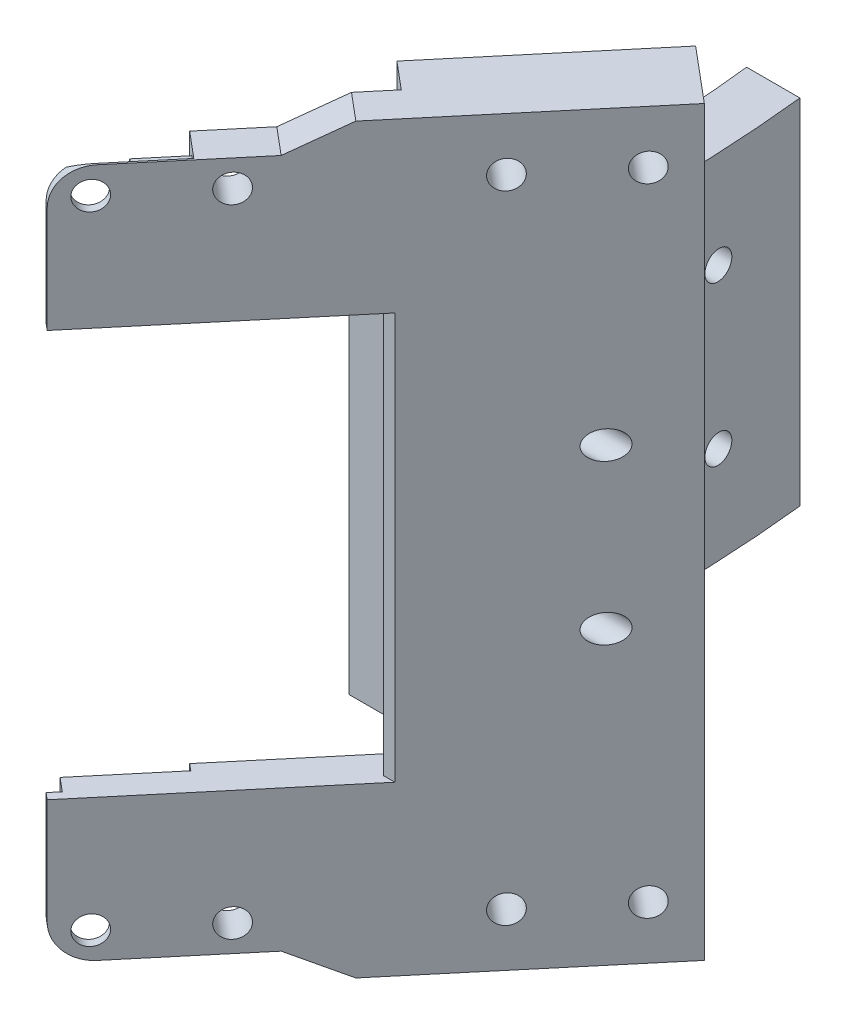
from build123d import *

# Parameters (mm, degrees)
EXTRUDE_1_DEPTH     = 1
SKETCH_2_W          = 24
SKETCH_2_H          = 84
EXTRUDE_2_DEPTH     = 8
CUT_EXTRUDE_1_DEPTH = 30
SKETCH_4_R          = 1.6
CUT_EXTRUDE_2_DEPTH = 12
SKETCH_5_W          = 60
SKETCH_5_H          = 46
CUT_EXTRUDE_3_DEPTH = 50
EXTRUDE_3_DEPTH     = 40
SKETCH_9_R          = 1.6
CUT_EXTRUDE_4_DEPTH = 70
EXTRUDE_8_DEPTH     = 6
EXTRUDE_9_DEPTH     = 6
SKETCH_18_W         = 10.5
SKETCH_18_H         = 9
EXTRUDE_11_DEPTH    = 3
SKETCH_21_W         = 5
SKETCH_21_H         = 6
EXTRUDE_13_DEPTH    = 2
EXTRUDE_14_DEPTH    = 4
SKETCH_24_R         = 1.6
CUT_EXTRUDE_7_DEPTH = 12


with BuildPart() as part:
    # 草图1 → 凸台-拉伸1 (new body)
    with BuildSketch(Plane(origin=(159.175409567, 0, 133.564027461), x_dir=(0.6427876096867067, 0, -0.7660444431188377), z_dir=(0.7660444431188378, 0, 0.6427876096867067))):
        with BuildLine():
            Line((166.587338197, -42), (166.587338197, 42))
            Line((166.587338197, 42), (138.587338197, 42))
            Line((138.587338197, 42), (132.587338197, 39))
            Line((132.587338197, 39), (117.787338197, 39))
            ThreePointArc((117.787338197, 39), (114.958911072, 37.828427125), (113.787338197, 35))
            Line((113.787338197, 35), (113.787338197, -35))
            ThreePointArc((113.787338197, -35), (114.958911072, -37.828427125), (117.787338197, -39))
            Line((117.787338197, -39), (132.587338197, -39))
            Line((132.587338197, -39), (138.587338197, -42))
            Line((138.587338197, -42), (166.587338197, -42))
        make_face()
    extrude(amount=-EXTRUDE_1_DEPTH)

    # 草图2 → 凸台-拉伸2 (add)
    with BuildSketch(Plane(origin=(159.175409567, 0, 133.564027461), x_dir=(0.6427876096867067, 0, -0.7660444431188377), z_dir=(0.7660444431188378, 0, 0.6427876096867067))):
        with Locations((154.587338197, 0)):
            Rectangle(SKETCH_2_W, SKETCH_2_H)
    extrude(amount=-EXTRUDE_2_DEPTH)

    # 草图3 → 切除-拉伸1 (cut)
    with BuildSketch(Plane(origin=(85.225498194, 0, -101.567793654), x_dir=(0.7660444431188381, 0, 0.6427876096867062), z_dir=(-0.6427876096867063, 0, 0.7660444431188381))):
        Polygon((206.788739932, -38.2), (207.588739932, -39), (207.588739932, -50), (197.788739932, -50), (197.788739932, -38.2), align=None)
        Polygon((206.788739932, 38.2), (207.588739932, 39), (207.588739932, 50), (197.788739932, 50), (197.788739932, 38.2), align=None)
    extrude(amount=CUT_EXTRUDE_1_DEPTH, mode=Mode.SUBTRACT)

    # 草图4 → 切除-拉伸2 (cut)
    with BuildSketch(Plane(origin=(159.175409567, 0, 133.564027461), x_dir=(0.6427876096867067, 0, -0.7660444431188377), z_dir=(0.7660444431188378, 0, 0.6427876096867067))):
        with Locations((117.287338197, -36)):
            Circle(SKETCH_4_R)
        with Locations((117.287338197, 36)):
            Circle(SKETCH_4_R)
        with Locations((150.687338197, 36)):
            Circle(SKETCH_4_R)
        with Locations((128.687338197, 36)):
            Circle(SKETCH_4_R)
        with Locations((128.687338197, -36)):
            Circle(SKETCH_4_R)
        with Locations((162.087338197, 36)):
            Circle(SKETCH_4_R)
        with Locations((162.087338197, -36)):
            Circle(SKETCH_4_R)
        with Locations((150.687338197, -36)):
            Circle(SKETCH_4_R)
    extrude(amount=-CUT_EXTRUDE_2_DEPTH, mode=Mode.SUBTRACT)

    # 草图5 → 切除-拉伸3 (cut)
    with BuildSketch(Plane.XY.offset(25)):
        with Locations((250, 0)):
            Rectangle(SKETCH_5_W, SKETCH_5_H)
    extrude(amount=CUT_EXTRUDE_3_DEPTH, mode=Mode.SUBTRACT)

    # 草图6 → 凸台-拉伸3 (add)
    with BuildSketch(Plane(origin=(0, 20, 0), x_dir=(-1, 0, 0), z_dir=(0, -1, 0))):
        with BuildLine():
            Line((-249.1237949, 22), (-243.086632908, 22))
            add(Edge.make_bspline(
                [(-243.086632908, 22), (-243.481254737, 18.531426174), (-243.784948463, 14.933770973), (-243.993041019, 11.223078881), (-244.1, 7.416444076), (-244.1, 3.53121788)],
                knots=[0.778865295, 0.778865295, 0.778865295, 0.778865295, 0.778865295, 0.778865295, 1, 1, 1, 1, 1, 1], degree=5))
            add(Edge.make_bspline(
                [(-244.1, 3.53121788), (-244.1, -1.069863619), (-243.955995612, -5.56513348), (-243.676385618, -9.929661799), (-243.268946043, -14.139045721), (-242.741071446, -18.169549128), (-242.097814731, -22)],
                knots=[0, 0, 0, 0, 0, 0, 0, 0.314254692, 0.314254692, 0.314254692, 0.314254692, 0.314254692, 0.314254692, 0.314254692], degree=6))
            Line((-242.097814731, -22), (-248.177885229, -22))
            add(Edge.make_bspline(
                [(-248.177885229, -22), (-248.800145217, -18.111595668), (-249.307087627, -14.054845034), (-249.696626763, -9.84368942), (-249.96306742, -5.496084567), (-250.1, -1.031127344), (-250.1, 3.53121788)],
                knots=[0.698640687, 0.698640687, 0.698640687, 0.698640687, 0.698640687, 0.698640687, 0.698640687, 1, 1, 1, 1, 1, 1, 1], degree=6))
            add(Edge.make_bspline(
                [(-250.1, 3.53121788), (-250.1, 7.398092065), (-249.997534101, 11.192091342), (-249.797793696, 14.899179655), (-249.505456591, 18.505771646), (-249.1237949, 22)],
                knots=[0, 0, 0, 0, 0, 0, 0.212850791, 0.212850791, 0.212850791, 0.212850791, 0.212850791, 0.212850791], degree=5))
        make_face()
    extrude(amount=EXTRUDE_3_DEPTH)

    # 草图9 → 切除-拉伸4 (cut)
    with BuildSketch(Plane(origin=(285, 0, 0), x_dir=(0, 0, -1), z_dir=(1, 0, 0))):
        with Locations((12, -9)):
            Circle(SKETCH_9_R)
        with Locations((-12, -9)):
            Circle(SKETCH_9_R)
        with Locations((12, 9)):
            Circle(SKETCH_9_R)
        with Locations((-12, 9)):
            Circle(SKETCH_9_R)
    extrude(amount=-CUT_EXTRUDE_4_DEPTH, mode=Mode.SUBTRACT)

    # 草图15 → 凸台-拉伸8 (add)
    with BuildSketch(Plane(origin=(0, -18.5, 0), x_dir=(-1, 0, 0), z_dir=(0, -1, 0))):
        Polygon((-265.489642048, -5.307935131), (-250.062739416, -23.693001766), (-245.519479642, -4.215866694), align=None)
    extrude(amount=-EXTRUDE_8_DEPTH)

    # 草图16 → 凸台-拉伸9 (add)
    with BuildSketch(Plane(origin=(0, 12.5, 0), x_dir=(-1, 0, 0), z_dir=(0, -1, 0))):
        Polygon((-265.489642048, -5.307935131), (-250.062739416, -23.693001766), (-245.519479642, -4.215866694), align=None)
    extrude(amount=-EXTRUDE_9_DEPTH)

    # 草图18 → 凸台-拉伸11 (add)
    with BuildSketch(Plane(origin=(159.175409567, 0, 133.564027461), x_dir=(0.6427876096867067, 0, -0.7660444431188377), z_dir=(0.7660444431188378, 0, 0.6427876096867067))):
        with Locations((120.337338197, 27.5)):
            Rectangle(SKETCH_18_W, SKETCH_18_H)
        with Locations((120.337338197, -27.5)):
            Rectangle(SKETCH_18_W, SKETCH_18_H)
    extrude(amount=-EXTRUDE_11_DEPTH)

    # 草图21 → 凸台-拉伸13 (add)
    with BuildSketch(Plane(origin=(159.175409567, 0, 133.564027461), x_dir=(0.6427876096867067, 0, -0.7660444431188377), z_dir=(0.7660444431188378, 0, 0.6427876096867067))):
        with Locations((123.087338197, 35)):
            Rectangle(SKETCH_21_W, SKETCH_21_H)
        with Locations((123.087338197, -35)):
            Rectangle(SKETCH_21_W, SKETCH_21_H)
    extrude(amount=-EXTRUDE_13_DEPTH)

    # 草图23 → 凸台-拉伸14 (add)
    with BuildSketch(Plane(origin=(159.175409567, 0, 133.564027461), x_dir=(0.6427876096867067, 0, -0.7660444431188377), z_dir=(0.7660444431188378, 0, 0.6427876096867067))):
        Polygon((143.587338197, -23), (143.587338197, -42), (138.587338197, -42), (132.587338197, -39), (125.587338197, -39), (125.587338197, -23), align=None)
        Polygon((143.587338197, 23), (143.587338197, 42), (138.587338197, 42), (132.587338197, 39), (125.587338197, 39), (125.587338197, 23), align=None)
    extrude(amount=-EXTRUDE_14_DEPTH)

    # 草图24 → 切除-拉伸7 (cut)
    with BuildSketch(Plane(origin=(159.175409567, 0, 133.564027461), x_dir=(0.6427876096867067, 0, -0.7660444431188377), z_dir=(0.7660444431188378, 0, 0.6427876096867067))):
        with Locations((162.087338197, -36)):
            Circle(SKETCH_24_R)
        with Locations((150.687338197, -36)):
            Circle(SKETCH_24_R)
        with Locations((128.687338197, -36)):
            Circle(SKETCH_24_R)
        with Locations((117.287338197, -36)):
            Circle(SKETCH_24_R)
        with Locations((162.087338197, 36)):
            Circle(SKETCH_24_R)
        with Locations((150.687338197, 36)):
            Circle(SKETCH_24_R)
        with Locations((128.687338197, 36)):
            Circle(SKETCH_24_R)
        with Locations((117.287338197, 36)):
            Circle(SKETCH_24_R)
    extrude(amount=-CUT_EXTRUDE_7_DEPTH, mode=Mode.SUBTRACT)


solid = part.part
